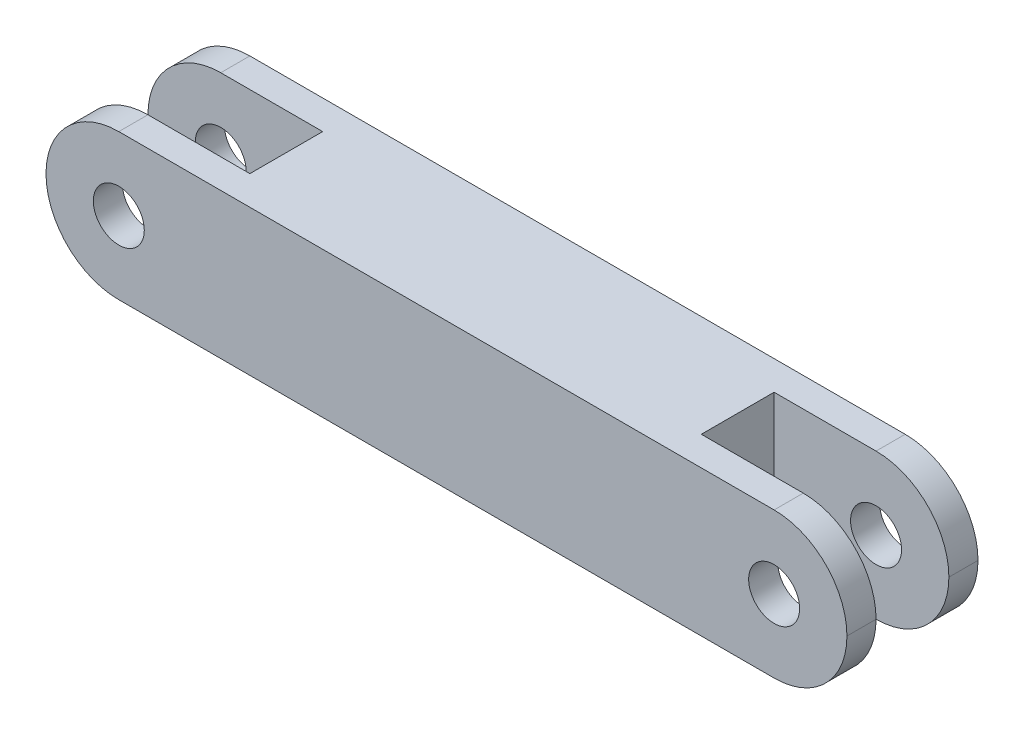
from build123d import *

# Parameters (mm, degrees)
SKETCH_5_W               = 55
SKETCH_5_H               = 9
EXTRUDE_1_DEPTH          = 10
FILLET_2_R               = 5
CUT_EXTRUDE_1_REACH      = 58.622
SKETCH_6_R               = 1.75
CUT_EXTRUDE_4_DEPTH      = 57.621550668
CUT_EXTRUDE_4_DEPTH_BACK = 57.621550668
SKETCH_7_W               = 12
SKETCH_7_H               = 5


with BuildPart() as part:
    # 草图5 → 凸台-拉伸1 (new body)
    with BuildSketch(Plane(origin=(0, 0, 0), x_dir=(1, 0, 0), z_dir=(0, 1, 0))):
        with Locations((27.5, -4.5)):
            Rectangle(SKETCH_5_W, SKETCH_5_H)
    extrude(amount=EXTRUDE_1_DEPTH)

    # 圆角2
    fillet_2_edges = [part.edges().sort_by_distance(p)[0] for p in [
        (55, 0, 4.5),
        (55, 10, 4.5),
        (0, 0, 4.5),
        (0, 10, 4.5),
    ]]
    fillet(fillet_2_edges, radius=FILLET_2_R - 0.0001)  # a hair under: the kernel refuses the full size

    # 草图6 → 切除-拉伸1 (cut, up to next)
    with BuildSketch(Plane.XY.offset(9), mode=Mode.PRIVATE) as cut_extrude_1_sk1:
        with Locations((5, 5)):
            Circle(SKETCH_6_R)
    cut_extrude_1_tool1 = extrude(cut_extrude_1_sk1.sketch, amount=-CUT_EXTRUDE_1_REACH, mode=Mode.PRIVATE) & part.part
    # 草图6 → 切除-拉伸1 (cut, up to next)
    with BuildSketch(Plane.XY.offset(9), mode=Mode.PRIVATE) as cut_extrude_1_sk2:
        with Locations((50, 5)):
            Circle(SKETCH_6_R)
    cut_extrude_1_tool2 = extrude(cut_extrude_1_sk2.sketch, amount=-CUT_EXTRUDE_1_REACH, mode=Mode.PRIVATE) & part.part
    add(cut_extrude_1_tool1.solids().sort_by_distance((5, 5, 9))[0], mode=Mode.SUBTRACT)
    add(cut_extrude_1_tool2.solids().sort_by_distance((50, 5, 9))[0], mode=Mode.SUBTRACT)

    # 草图7 → 切除-拉伸4 (cut, two sides: drawn at the far end of the back side and taken through both)
    with BuildSketch(Plane(origin=(0, 0, 0), x_dir=(1, 0, 0), z_dir=(0, 1, 0)).offset(-CUT_EXTRUDE_4_DEPTH_BACK)):
        with Locations((6, -4.5)):
            Rectangle(SKETCH_7_W, SKETCH_7_H)
        with Locations((49, -4.5)):
            Rectangle(SKETCH_7_W, SKETCH_7_H)
    extrude(amount=CUT_EXTRUDE_4_DEPTH + CUT_EXTRUDE_4_DEPTH_BACK, mode=Mode.SUBTRACT)


solid = part.part
